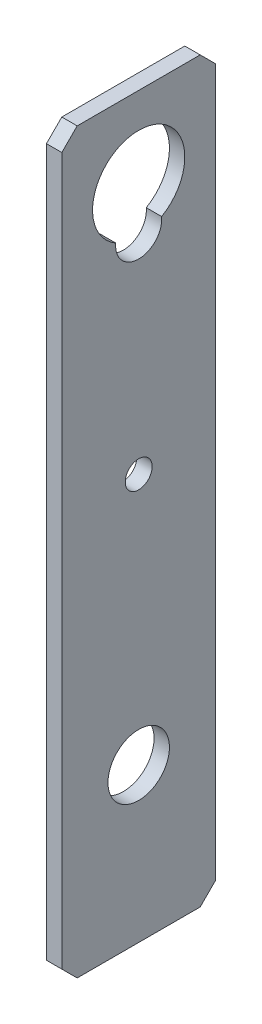
from build123d import *

# Parameters (mm, degrees)
SKETCH1_W           = 20
SKETCH1_H           = 96
BOSS_EXTRUDE2_DEPTH = 2
SKETCH3_R           = 1.75
SKETCH3_R_2         = 4
CUT_EXTRUDE1_DEPTH  = 50.071376586
CHAMFER1_SIZE       = 2


with BuildPart() as part:
    # Sketch1 → Boss-Extrude2 (new body)
    with BuildSketch(Plane(origin=(0, 0, 0), x_dir=(0, 0, -1), z_dir=(1, 0, 0))):
        Rectangle(SKETCH1_W, SKETCH1_H)
    extrude(amount=BOSS_EXTRUDE2_DEPTH)

    # Sketch3 → Cut-Extrude1 (cut, through all)
    with BuildSketch(Plane(origin=(2, 0, 0), x_dir=(0, 0, -1), z_dir=(1, 0, 0))):
        with Locations((0, 4.75)):
            Circle(SKETCH3_R)
        with Locations((0, -28)):
            Circle(SKETCH3_R_2)
        with BuildLine():
            ThreePointArc((2.985415651, 32.295454545), (0, 43.5), (-2.985415651, 32.295454545))
            ThreePointArc((-2.985415651, 32.295454545), (0, 29), (2.985415651, 32.295454545))
        make_face()
    extrude(amount=-CUT_EXTRUDE1_DEPTH, mode=Mode.SUBTRACT)

    # Chamfer1
    chamfer1_edges = [part.edges().sort_by_distance(p)[0] for p in [
        (1, -48, 10),
        (1, -48, -10),
        (1, 48, -10),
        (1, 48, 10),
    ]]
    chamfer(chamfer1_edges, length=CHAMFER1_SIZE)


solid = part.part
